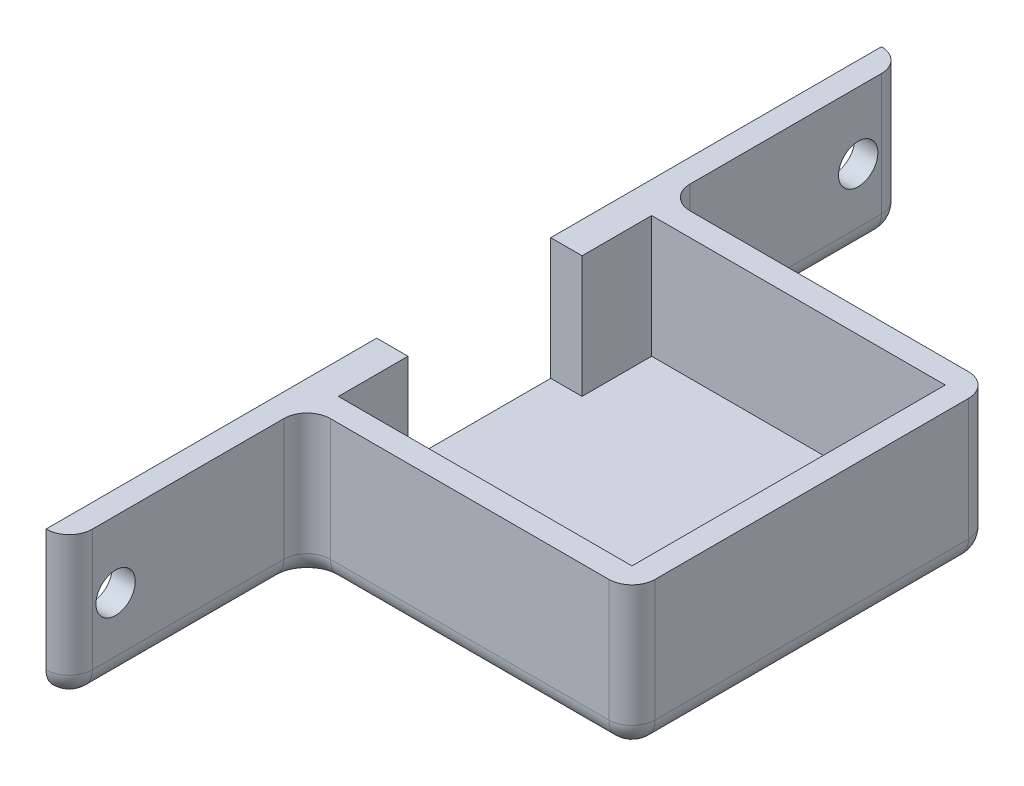
from build123d import *

# Parameters (mm, degrees)
SKETCH1_W           = 35.56
SKETCH1_H           = 34.29
BOSS_EXTRUDE1_DEPTH = 2.54
BOSS_EXTRUDE4_DEPTH = 15.875
SKETCH6_W           = 2.54
SKETCH6_H           = 15.875
BOSS_EXTRUDE5_DEPTH = 26.035
SKETCH7_W           = 2.54
SKETCH7_H           = 15.875
BOSS_EXTRUDE6_DEPTH = 26.035
CUT_EXTRUDE1_REACH  = 77.204
SKETCH8_R           = 2.15265
FILLET1_R           = 2.54
SKETCH10_W          = 3.429
SKETCH10_H          = 7.62
BOSS_EXTRUDE7_DEPTH = 13.335


with BuildPart() as part:
    # Sketch1 → Boss-Extrude1 (new body)
    with BuildSketch(Plane(origin=(0, 0, 0), x_dir=(1, 0, 0), z_dir=(0, 1, 0))):
        with Locations((17.78, 17.145)):
            Rectangle(SKETCH1_W, SKETCH1_H)
    extrude(amount=BOSS_EXTRUDE1_DEPTH)

    # Sketch2 → Boss-Extrude4 (add)
    with BuildSketch(Plane(origin=(0, 0, 0), x_dir=(1, 0, 0), z_dir=(0, 1, 0))):
        Polygon((0, 34.29), (0, 36.83), (38.1, 36.83), (38.1, -2.54), (0, -2.54), (0, 0), (35.56, 0), (35.56, 34.29), align=None)
    extrude(amount=BOSS_EXTRUDE4_DEPTH)

    # Sketch6 → Boss-Extrude5 (add)
    with BuildSketch(Plane.XY.offset(2.54)):
        with Locations((1.27, 7.9375)):
            Rectangle(SKETCH6_W, SKETCH6_H)
    extrude(amount=BOSS_EXTRUDE5_DEPTH)

    # Sketch7 → Boss-Extrude6 (add)
    with BuildSketch(Plane(origin=(0, 0, -36.83), x_dir=(-1, 0, 0), z_dir=(0, 0, -1))):
        with Locations((-1.27, 7.9375)):
            Rectangle(SKETCH7_W, SKETCH7_H)
    extrude(amount=BOSS_EXTRUDE6_DEPTH)

    # Sketch8 → Cut-Extrude1 (cut, up to next)
    with BuildSketch(Plane.ZY, mode=Mode.PRIVATE) as cut_extrude1_sk1:
        with Locations((-57.785, 8.5725)):
            Circle(SKETCH8_R)
    cut_extrude1_tool1 = extrude(cut_extrude1_sk1.sketch, amount=-CUT_EXTRUDE1_REACH, mode=Mode.PRIVATE) & part.part
    # Sketch8 → Cut-Extrude1 (cut, up to next)
    with BuildSketch(Plane.ZY, mode=Mode.PRIVATE) as cut_extrude1_sk2:
        with Locations(Location((23.495, 8.5725, 0), (0, 0, 270))):
            Circle(SKETCH8_R)
    cut_extrude1_tool2 = extrude(cut_extrude1_sk2.sketch, amount=-CUT_EXTRUDE1_REACH, mode=Mode.PRIVATE) & part.part
    add(cut_extrude1_tool1.solids().sort_by_distance((0, 8.5725, -57.785))[0], mode=Mode.SUBTRACT)
    add(cut_extrude1_tool2.solids().sort_by_distance((0, 8.5725, 23.495))[0], mode=Mode.SUBTRACT)

    # Fillet1
    # the kernel refuses this fillet: 2.54 mm, written as the material it adds along each edge
    with BuildSketch(Plane(origin=(2.54, 15.875, -36.83), x_dir=(1, 0, 0), z_dir=(0, -1, 0))) as fillet1_piece_1:
        with BuildLine():
            CenterArc((FILLET1_R, -FILLET1_R), FILLET1_R, 90, 90)
            Line((0, -FILLET1_R), (0, 0))
            Line((0, 0), (FILLET1_R, 0))
        make_face()
    extrude(amount=15.875)
    with BuildSketch(Plane(origin=(2.54, 15.875, 2.54), x_dir=(1, 0, 0), z_dir=(0, -1, 0))) as fillet1_piece_2:
        with BuildLine():
            CenterArc((FILLET1_R, FILLET1_R), FILLET1_R, 180, 90)
            Line((0, FILLET1_R), (0, 0))
            Line((0, 0), (FILLET1_R, 0))
        make_face()
    extrude(amount=15.875)
    # the kernel refuses this fillet: 2.54 mm, written as the material it takes off along each edge
    with BuildSketch(Plane(origin=(38.1, -6.35, -36.83), x_dir=(0, 0, 1), z_dir=(0, 1, 0)), Plane(origin=(38.1, -6.35, 2.54), x_dir=(-1, 0, 0), z_dir=(0, 1, 0)), Plane(origin=(2.54, 22.225, -62.865), x_dir=(-1, 0, 0), z_dir=(0, -1, 0))) as fillet1_2_piece_1:
        with BuildLine():
            CenterArc((FILLET1_R, -FILLET1_R), FILLET1_R, 90, 90)
            Line((0, -FILLET1_R), (0, 0))
            Line((0, 0), (FILLET1_R, 0))
        make_face()
    extrude(amount=28.575, mode=Mode.SUBTRACT)
    with BuildSketch(Plane(origin=(2.54, 22.225, 28.575), x_dir=(-1, 0, 0), z_dir=(0, -1, 0))) as fillet1_2_piece_2:
        with BuildLine():
            CenterArc((FILLET1_R, FILLET1_R), FILLET1_R, 180, 90)
            Line((0, FILLET1_R), (0, 0))
            Line((0, 0), (FILLET1_R, 0))
        make_face()
    extrude(amount=28.575, mode=Mode.SUBTRACT)
    with BuildSketch(Plane(origin=(38.1, 0, -43.18), x_dir=(-1, 0, 0), z_dir=(0, 0, 1))) as fillet1_2_piece_3:
        with BuildLine():
            CenterArc((FILLET1_R, -FILLET1_R), FILLET1_R, 90, 90)
            Line((0, -FILLET1_R), (0, 0))
            Line((0, 0), (FILLET1_R, 0))
        make_face()
    extrude(amount=52.07, mode=Mode.SUBTRACT)
    # the kernel refuses this fillet: 2.54 mm, written as the material it takes off along each edge
    with BuildSketch(Plane(origin=(35.56, 2.54, 0), x_dir=(0, 0, 1), z_dir=(0, -1, 0))) as fillet1_3_piece_1_section:
        Polygon((0, 0), (FILLET1_R, 0), (FILLET1_R, -FILLET1_R), (0, -FILLET1_R), align=None)
    fillet1_3_piece_1 = extrude(amount=FILLET1_R, mode=Mode.PRIVATE)
    fillet1_3_piece_1 = fillet1_3_piece_1 - Plane(origin=(35.56, 2.54, 0), x_dir=(-0.7071067811865475, 0, -0.7071067811865475), z_dir=(0, -1, 0)) * Sphere(FILLET1_R, mode=Mode.PRIVATE)
    add(fillet1_3_piece_1, mode=Mode.SUBTRACT)
    with BuildSketch(Plane(origin=(35.56, 2.54, -34.29), x_dir=(0, 0, -1), z_dir=(0, -1, 0))) as fillet1_3_piece_2_section:
        Polygon((0, 0), (FILLET1_R, 0), (FILLET1_R, FILLET1_R), (0, FILLET1_R), align=None)
    fillet1_3_piece_2 = extrude(amount=FILLET1_R, mode=Mode.PRIVATE)
    fillet1_3_piece_2 = fillet1_3_piece_2 - Plane(origin=(35.56, 2.54, -34.29), x_dir=(-0.7071067811865475, 0, 0.7071067811865475), z_dir=(0, -1, 0)) * Sphere(FILLET1_R, mode=Mode.PRIVATE)
    add(fillet1_3_piece_2, mode=Mode.SUBTRACT)
    with BuildSketch(Plane(origin=(2.54, 0, -39.37), x_dir=(-1, 0, 0), z_dir=(0, 0, -1))) as fillet1_3_piece_3:
        with BuildLine():
            CenterArc((FILLET1_R, FILLET1_R), FILLET1_R, 180, 90)
            Line((0, FILLET1_R), (0, 0))
            Line((0, 0), (FILLET1_R, 0))
        make_face()
    extrude(amount=20.955, mode=Mode.SUBTRACT)
    with BuildSketch(Plane(origin=(5.08, 0, -36.83), x_dir=(0, 0, 1), z_dir=(1, 0, 0)), Plane(origin=(35.56, 0, 2.54), x_dir=(0, 0, -1), z_dir=(-1, 0, 0))) as fillet1_3_piece_4:
        with BuildLine():
            CenterArc((FILLET1_R, -FILLET1_R), FILLET1_R, 90, 90)
            Line((0, -FILLET1_R), (0, 0))
            Line((0, 0), (FILLET1_R, 0))
        make_face()
    extrude(amount=30.48, mode=Mode.SUBTRACT)
    with BuildSketch(Plane(origin=(2.54, 0, 5.08), x_dir=(-1, 0, 0), z_dir=(0, 0, 1))) as fillet1_3_piece_5:
        with BuildLine():
            CenterArc((FILLET1_R, -FILLET1_R), FILLET1_R, 90, 90)
            Line((0, -FILLET1_R), (0, 0))
            Line((0, 0), (FILLET1_R, 0))
        make_face()
    extrude(amount=20.955, mode=Mode.SUBTRACT)
    with BuildSketch(Plane(origin=(5.08, 0, 5.08), x_dir=(0, 0, -1), z_dir=(1, 0, 0))) as fillet1_3_piece_6:
        with BuildLine():
            CenterArc((2.54 + FILLET1_R, FILLET1_R), FILLET1_R, 180, 90)
            Line((2.54, FILLET1_R), (2.54, 0))
            Line((2.54, 0), (2.54 + FILLET1_R, 0))
        make_face()
    revolve(axis=Axis((5.08, 0, 5.08), (0, 1, 0)), revolution_arc=90, mode=Mode.SUBTRACT)
    with BuildSketch(Plane(origin=(0, 0, 26.035), x_dir=(-0.5976672776328251, 0, -0.8017442392976499), z_dir=(0.8017442392976499, 0, -0.5976672776328251))) as fillet1_3_piece_7:
        with BuildLine():
            CenterArc((2.54 - FILLET1_R, FILLET1_R), FILLET1_R, 270, 90)
            Line((2.54, FILLET1_R), (2.54, 0))
            Line((2.54, 0), (2.54 - FILLET1_R, 0))
        make_face()
    revolve(axis=Axis((0, 0, 26.035), (0, 1, 0)), revolution_arc=233.296989237, mode=Mode.SUBTRACT)
    with BuildSketch(Plane(origin=(5.08, 0, -39.37), x_dir=(0, 0, 1), z_dir=(1, 0, 0))) as fillet1_3_piece_8:
        with BuildLine():
            CenterArc((2.54 + FILLET1_R, -FILLET1_R), FILLET1_R, 90, 90)
            Line((2.54, -FILLET1_R), (2.54, 0))
            Line((2.54, 0), (2.54 + FILLET1_R, 0))
        make_face()
    revolve(axis=Axis((5.08, 0, -39.37), (0, -1, 0)), revolution_arc=90, mode=Mode.SUBTRACT)
    with BuildSketch(Plane(origin=(0, 0, -60.325), x_dir=(1, 0, 0), z_dir=(0, 0, 1))) as fillet1_3_piece_9:
        with BuildLine():
            CenterArc((2.54 - FILLET1_R, FILLET1_R), FILLET1_R, 270, 90)
            Line((2.54, FILLET1_R), (2.54, 0))
            Line((2.54, 0), (2.54 - FILLET1_R, 0))
        make_face()
    revolve(axis=Axis((0, 0, -60.325), (0, 1, 0)), revolution_arc=233.296989237, mode=Mode.SUBTRACT)

    # Sketch10 → Boss-Extrude7 (add)
    with BuildSketch(Plane(origin=(0, 2.54, 0), x_dir=(1, 0, 0), z_dir=(0, 1, 0))):
        with Locations((1.7145, 30.48)):
            Rectangle(SKETCH10_W, SKETCH10_H)
        with Locations((1.7145, 3.81)):
            Rectangle(SKETCH10_W, SKETCH10_H)
    extrude(amount=BOSS_EXTRUDE7_DEPTH)


solid = part.part
